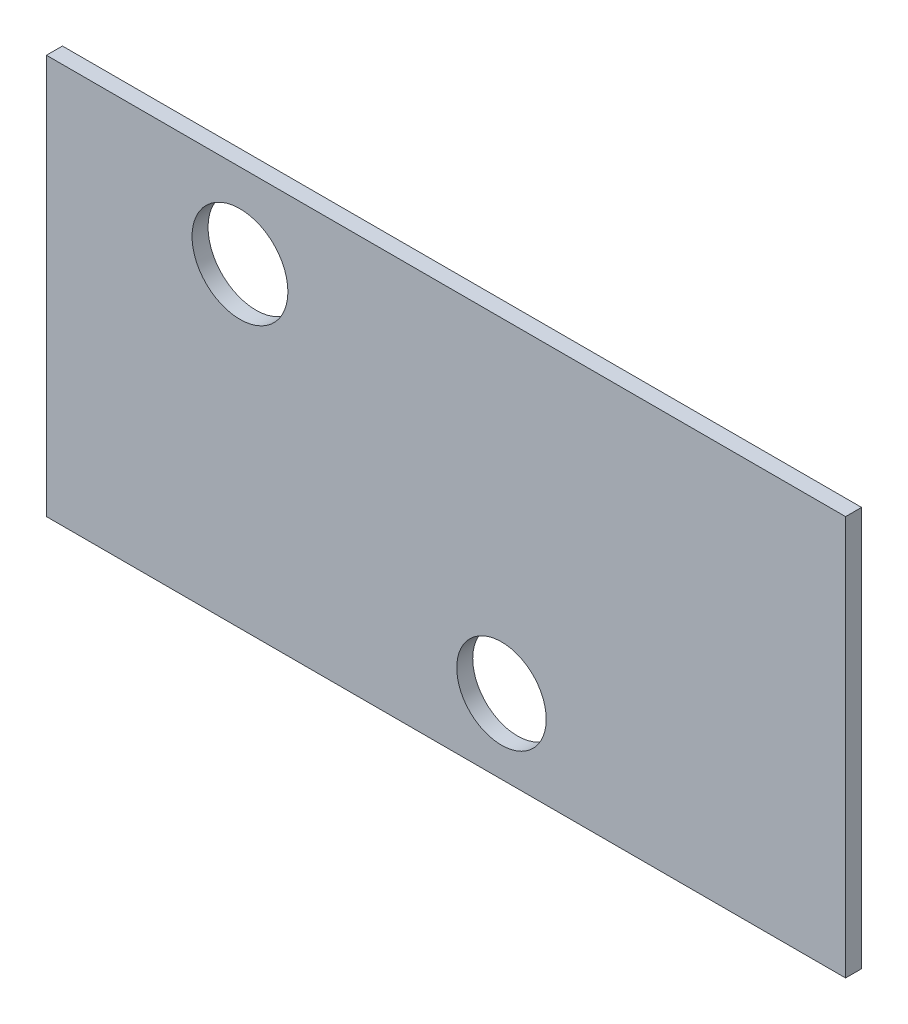
from build123d import *

# Parameters (mm, degrees)
SKETCH1_W           = 150
SKETCH1_H           = 75
BOSS_EXTRUDE1_DEPTH = 3
SKETCH2_R           = 8.994906111
SKETCH2_R_2         = 8.400696466
CUT_EXTRUDE1_DEPTH  = 10


with BuildPart() as part:
    # Sketch1 → Boss-Extrude1 (new body)
    with BuildSketch(Plane.XY):
        with Locations((75, 37.5)):
            Rectangle(SKETCH1_W, SKETCH1_H)
    extrude(amount=BOSS_EXTRUDE1_DEPTH)

    # Sketch2 → Cut-Extrude1 (cut)
    with BuildSketch(Plane.XY.offset(3)):
        with Locations((36.327910431, 59.217033853)):
            Circle(SKETCH2_R)
        with Locations((85.413576885, 13.949141457)):
            Circle(SKETCH2_R_2)
    extrude(amount=-CUT_EXTRUDE1_DEPTH, mode=Mode.SUBTRACT)


solid = part.part
